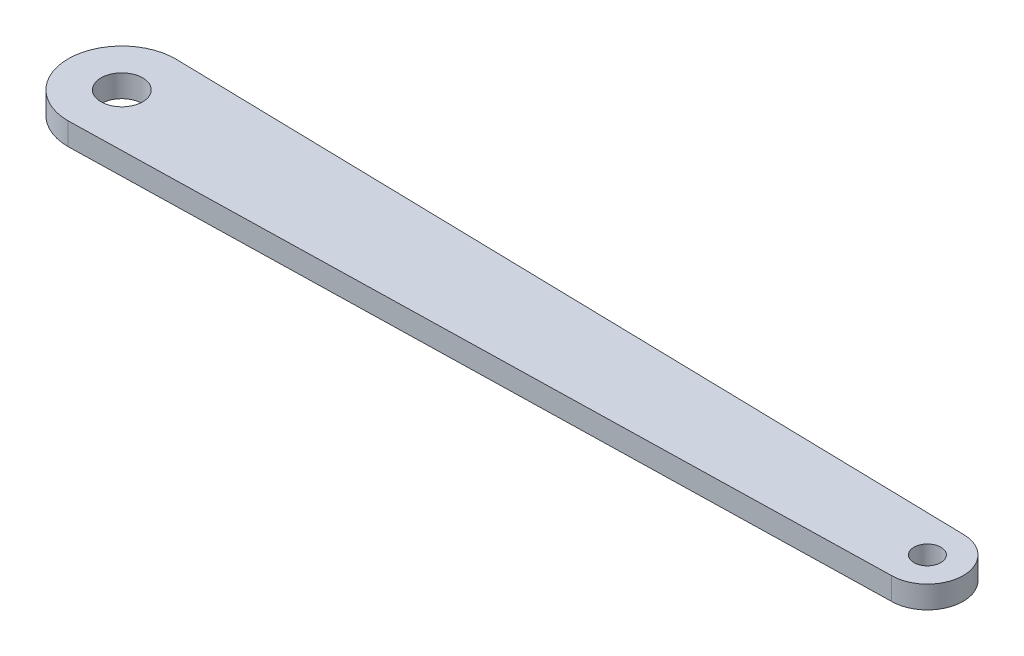
from build123d import *

# Parameters (mm, degrees)
SKETCH1_R           = 4.65
BOSS_EXTRUDE1_DEPTH = 5
SKETCH2_R           = 3
CUT_EXTRUDE1_DEPTH  = 189.448932074


with BuildPart() as part:
    # Sketch1 → Boss-Extrude1 (new body)
    with BuildSketch(Plane(origin=(0, 0, 0), x_dir=(1, 0, 0), z_dir=(0, 1, 0))):
        with BuildLine():
            ThreePointArc((180, -8), (187.999506097, -0.088894377), (180.177777778, 7.998024447))
            Line((180.177777778, 7.998024447), (0.266666667, 11.997036671))
            ThreePointArc((0.266666667, 11.997036671), (-11.999259145, 0.133341566), (0, -12))
            Line((0, -12), (0.533070089, -11.988153998))
            Line((0.533070089, -11.988153998), (180, -8))
        make_face()
        Circle(SKETCH1_R, mode=Mode.SUBTRACT)
    extrude(amount=BOSS_EXTRUDE1_DEPTH)

    # Sketch2 → Cut-Extrude1 (cut, through all)
    with BuildSketch(Plane(origin=(0, 5, 0), x_dir=(1, 0, 0), z_dir=(0, 1, 0))):
        with Locations((180, 0)):
            Circle(SKETCH2_R)
    extrude(amount=-CUT_EXTRUDE1_DEPTH, mode=Mode.SUBTRACT)


solid = part.part
